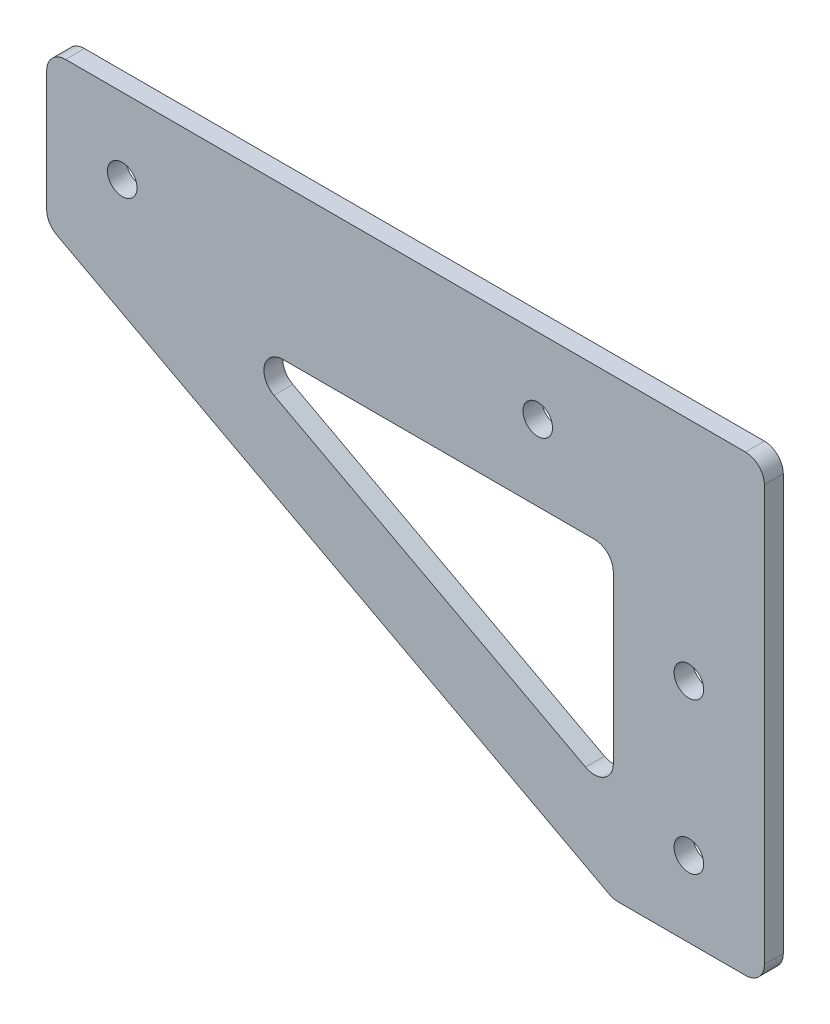
from build123d import *

# Parameters (mm, degrees)
BOSS_EXTRUDE1_DEPTH = 3.175
FILLET2_R           = 3.175
SKETCH2_R           = 2.4892
CUT_EXTRUDE1_DEPTH  = 143.733819135


with BuildPart() as part:
    # Sketch1 → Boss-Extrude1 (new body)
    with BuildSketch(Plane.XY):
        Polygon((-120.65, 50.8), (-25.4, 0), (0, 0), (0, 76.2), (-120.65, 76.2), align=None)
        Polygon((-93.6625, 50.8), (-25.4, 50.8), (-25.4, 14.393333333), align=None, mode=Mode.SUBTRACT)
    extrude(amount=-BOSS_EXTRUDE1_DEPTH)

    # Fillet2
    fillet2_edges = [part.edges().sort_by_distance(p)[0] for p in [
        (0, 0, -1.5875),
        (0, 76.2, -1.5875),
        (-120.65, 76.2, -1.5875),
        (-25.4, 0, -1.5875),
        (-120.65, 50.8, -1.5875),
        (-93.6625, 50.8, -1.5875),
        (-25.4, 14.393333333, -1.5875),
        (-25.4, 50.8, -1.5875),
    ]]
    fillet(fillet2_edges, radius=FILLET2_R)

    # Sketch2 → Cut-Extrude1 (cut, through all)
    with BuildSketch(Plane.XY):
        with Locations((-12.7, 38.1)):
            Circle(SKETCH2_R)
        with Locations((-12.7, 12.7)):
            Circle(SKETCH2_R)
        with Locations((-38.1, 63.5)):
            Circle(SKETCH2_R)
        with Locations((-107.95, 63.5)):
            Circle(SKETCH2_R)
    extrude(amount=-CUT_EXTRUDE1_DEPTH, mode=Mode.SUBTRACT)


solid = part.part
